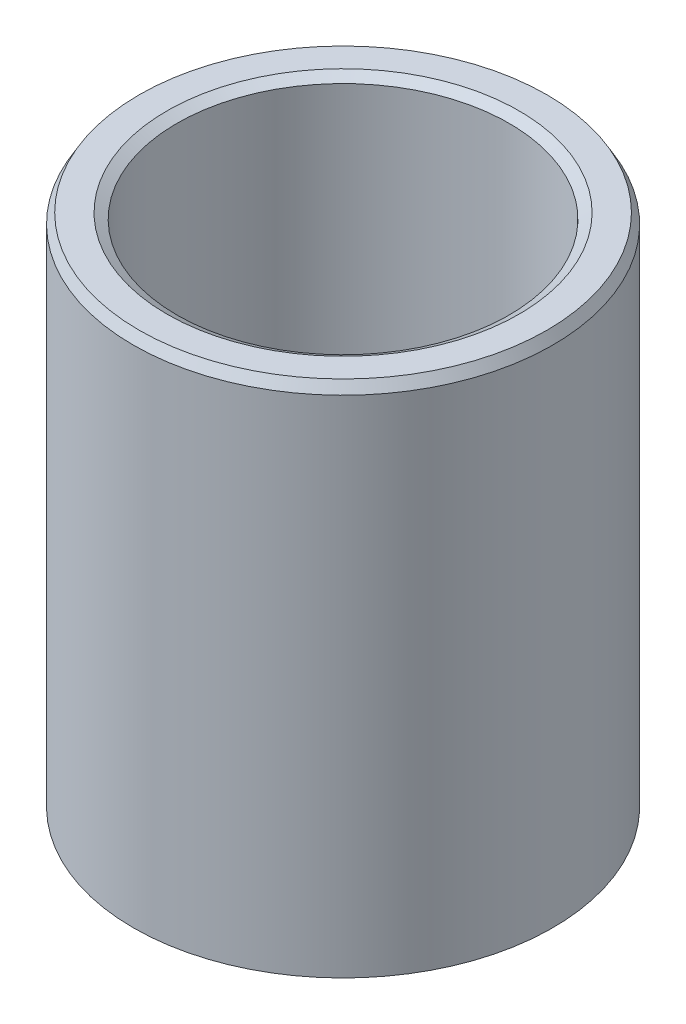
from build123d import *
from OCP.BRepFilletAPI import BRepFilletAPI_MakeChamfer

# Parameters (mm, degrees)
SKETCH1_R           = 17.5
BOSS_EXTRUDE1_DEPTH = 43.432863284
SKETCH2_R           = 13.861863003
CUT_EXTRUDE1_DEPTH  = 50.98913495
CHAMFER1_SIZE       = 0.835014079
CHAMFER1_SIZE2      = 0.482095603


with BuildPart() as part:
    # Sketch1 → Boss-Extrude1 (new body)
    with BuildSketch(Plane(origin=(0, 0, 0), x_dir=(1, 0, 0), z_dir=(0, 1, 0))):
        Circle(SKETCH1_R)
    extrude(amount=BOSS_EXTRUDE1_DEPTH)

    # Sketch2 → Cut-Extrude1 (cut, through all)
    with BuildSketch(Plane(origin=(0, 0, 0), x_dir=(1, 0, 0), z_dir=(0, 1, 0))):
        Circle(SKETCH2_R)
    extrude(amount=CUT_EXTRUDE1_DEPTH, mode=Mode.SUBTRACT)

    # Chamfer1: one chamfer whose edges measure the first distance from different faces: ONE call of the kernel's chamfer builder (chamfer() names one face for all edges)
    chamfer1_edges_1 = [part.edges().sort_by_distance(p)[0] for p in [
        (-13.861863003, 43.432863284, 0),
    ]]
    chamfer1_side_1 = [part.faces().sort_by_distance(p)[0] for p in [
        (-17.005025253, 43.432863284, 0),
    ]]
    chamfer1_edges_2 = [part.edges().sort_by_distance(p)[0] for p in [
        (-13.861863003, 0, 0),
    ]]
    chamfer1_side_2 = [part.faces().sort_by_distance(p)[0] for p in [
        (-13.861863003, 21.716431642, 0),
    ]]
    chamfer1_edges_3 = [part.edges().sort_by_distance(p)[0] for p in [
        (-17.5, 0, 0),
    ]]
    chamfer1_side_3 = [part.faces().sort_by_distance(p)[0] for p in [
        (-17.005025253, 0, 0),
    ]]
    chamfer1_edges_4 = [part.edges().sort_by_distance(p)[0] for p in [
        (-17.5, 43.432863284, 0),
    ]]
    chamfer1_side_4 = [part.faces().sort_by_distance(p)[0] for p in [
        (-17.5, 21.716431642, 0),
    ]]
    chamfer1 = BRepFilletAPI_MakeChamfer(part.part.solid().wrapped)
    for e in chamfer1_edges_1:
        chamfer1.Add(CHAMFER1_SIZE, CHAMFER1_SIZE2, e.wrapped, chamfer1_side_1[0].wrapped)  # the first distance lies on this face
    for e in chamfer1_edges_2:
        chamfer1.Add(CHAMFER1_SIZE, CHAMFER1_SIZE2, e.wrapped, chamfer1_side_2[0].wrapped)  # the first distance lies on this face
    for e in chamfer1_edges_3:
        chamfer1.Add(CHAMFER1_SIZE, CHAMFER1_SIZE2, e.wrapped, chamfer1_side_3[0].wrapped)  # the first distance lies on this face
    for e in chamfer1_edges_4:
        chamfer1.Add(CHAMFER1_SIZE, CHAMFER1_SIZE2, e.wrapped, chamfer1_side_4[0].wrapped)  # the first distance lies on this face
    add(Compound.cast(chamfer1.Shape()), mode=Mode.REPLACE)


solid = part.part
